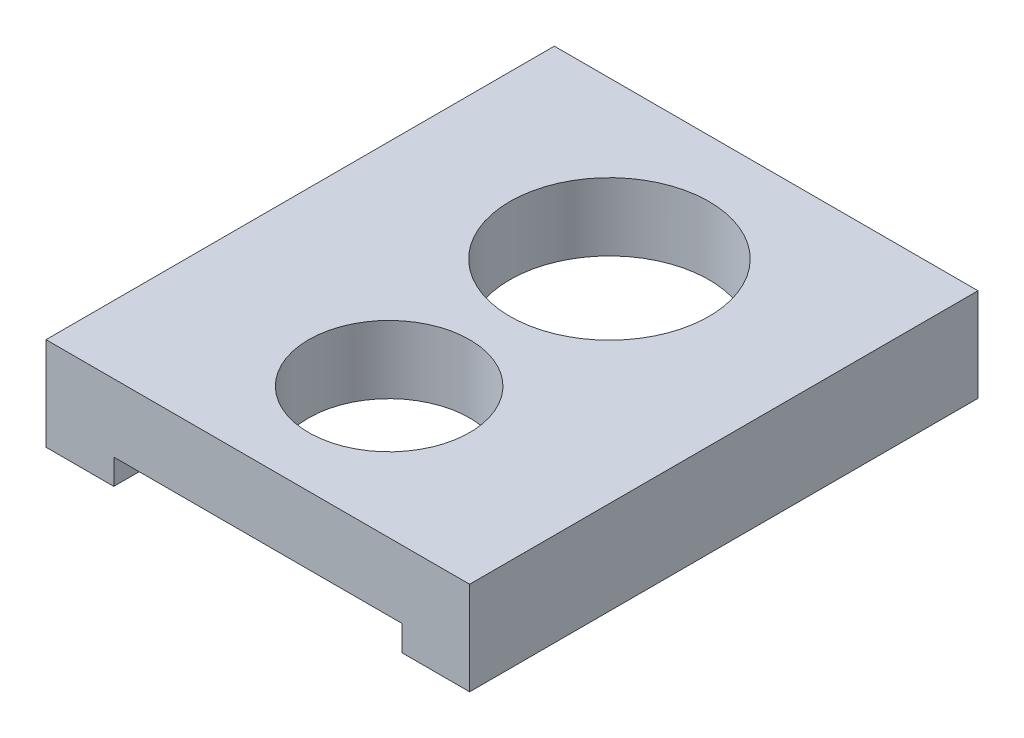
from build123d import *

# Parameters (mm, degrees)
EXTRUDE_1_DEPTH     = 60
SKETCH_2_R          = 11.75
CUT_EXTRUDE_1_DEPTH = 40
SKETCH_3_R          = 9.5
CUT_EXTRUDE_2_DEPTH = 40


with BuildPart() as part:
    # 草圖1 → 填料-伸長1 (new body)
    with BuildSketch(Plane.XY):
        Polygon((-25, 0), (-17, 0), (-17, 3), (17, 3), (17, 0), (25, 0), (25, 11), (-25, 11), align=None)
    extrude(amount=EXTRUDE_1_DEPTH)

    # 草圖2 → 除料-伸長1 (cut)
    with BuildSketch(Plane(origin=(0, 11, 0), x_dir=(1, 0, 0), z_dir=(0, 1, 0))):
        with Locations((0, -18.5)):
            Circle(SKETCH_2_R)
    extrude(amount=-CUT_EXTRUDE_1_DEPTH, mode=Mode.SUBTRACT)

    # 草圖3 → 除料-伸長2 (cut)
    with BuildSketch(Plane(origin=(0, 11, 0), x_dir=(1, 0, 0), z_dir=(0, 1, 0))):
        with Locations((0, -44.5)):
            Circle(SKETCH_3_R)
    extrude(amount=-CUT_EXTRUDE_2_DEPTH, mode=Mode.SUBTRACT)


solid = part.part
